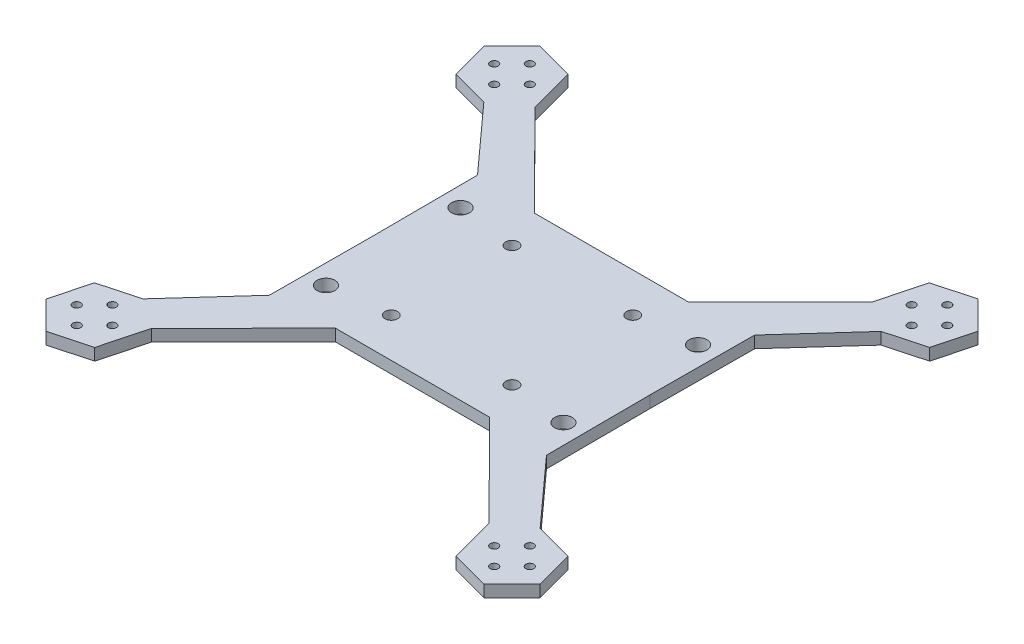
from build123d import *

# Parameters (mm, degrees)
SKETCH1_R           = 1
SKETCH1_R_2         = 2.25
SKETCH1_R_3         = 1.6
BOSS_EXTRUDE1_DEPTH = 3
SKETCH4_R           = 6.495043718
SKETCH4_R_2         = 4.9
BOSS_EXTRUDE3_DEPTH = 5
SKETCH6_W           = 8.48311055
SKETCH6_H           = 1.891574962
CUT_EXTRUDE3_DEPTH  = 34


with BuildPart() as part:
    # Sketch1 → Boss-Extrude1 (new body)
    with BuildSketch(Plane(origin=(0, 0, 0), x_dir=(1, 0, 0), z_dir=(0, 1, 0))):
        Polygon((43.076410298, 50.123925917), (42.618597625, 48.402115535), (19.4637773, 25.158118275), (-19.4637773, 25.158118275), (-42.618597625, 48.402115535), (-45.64603124, 59.788140743), (-55.300297258, 62.394891143), (-62.384942335, 55.337426715), (-59.815321393, 45.673211889), (-50.185022628, 43.072932893), (-35, 26.288270568), (-34.873, 0), (-35, -26.288270568), (-50.185022628, -43.072932893), (-59.815321393, -45.673211889), (-62.384942335, -55.337426715), (-55.300297258, -62.394891143), (-45.64603124, -59.788140743), (-42.618597625, -48.402115535), (-19.4637773, -25.158118275), (19.4637773, -25.158118275), (42.618597625, -48.402115535), (45.64603124, -59.788140743), (55.300297258, -62.394891143), (62.384942335, -55.337426715), (59.815321393, -45.673211889), (50.185022628, -43.072932893), (35, -26.288270568), (34.873, 0), (35, 26.288270568), (50.185022628, 43.072932893), (59.815321393, 45.673211889), (62.384942335, 55.337426715), (55.300297258, 62.394891143), (45.64603124, 59.788140743), align=None)
        with Locations((-52.730676316, -57.230676316)):
            Circle(SKETCH1_R, mode=Mode.SUBTRACT)
        with Locations((-57.230676316, -52.730676316)):
            Circle(SKETCH1_R, mode=Mode.SUBTRACT)
        with Locations((-48.230676316, -52.730676316)):
            Circle(SKETCH1_R, mode=Mode.SUBTRACT)
        with Locations((-52.730676316, -48.230676316)):
            Circle(SKETCH1_R, mode=Mode.SUBTRACT)
        with Locations((-30, -17)):
            Circle(SKETCH1_R_2, mode=Mode.SUBTRACT)
        with Locations((-15.25, -15.25)):
            Circle(SKETCH1_R_3, mode=Mode.SUBTRACT)
        with Locations((52.730676316, -57.230676316)):
            Circle(SKETCH1_R, mode=Mode.SUBTRACT)
        with Locations((48.230676316, -52.730676316)):
            Circle(SKETCH1_R, mode=Mode.SUBTRACT)
        with Locations((52.730676316, -48.230676316)):
            Circle(SKETCH1_R, mode=Mode.SUBTRACT)
        with Locations((57.230676316, -52.730676316)):
            Circle(SKETCH1_R, mode=Mode.SUBTRACT)
        with Locations((30, -17)):
            Circle(SKETCH1_R_2, mode=Mode.SUBTRACT)
        with Locations((15.25, -15.25)):
            Circle(SKETCH1_R_3, mode=Mode.SUBTRACT)
        with Locations((-15.25, 15.25)):
            Circle(SKETCH1_R_3, mode=Mode.SUBTRACT)
        with Locations((-30, 17)):
            Circle(SKETCH1_R_2, mode=Mode.SUBTRACT)
        with Locations((-57.230676316, 52.730676316)):
            Circle(SKETCH1_R, mode=Mode.SUBTRACT)
        with Locations((-52.730676316, 48.230676316)):
            Circle(SKETCH1_R, mode=Mode.SUBTRACT)
        with Locations((-48.230676316, 52.730676316)):
            Circle(SKETCH1_R, mode=Mode.SUBTRACT)
        with Locations((-52.730676316, 57.230676316)):
            Circle(SKETCH1_R, mode=Mode.SUBTRACT)
        with Locations((15.25, 15.25)):
            Circle(SKETCH1_R_3, mode=Mode.SUBTRACT)
        with Locations((30, 17)):
            Circle(SKETCH1_R_2, mode=Mode.SUBTRACT)
        with Locations((52.730676316, 48.230676316)):
            Circle(SKETCH1_R, mode=Mode.SUBTRACT)
        with Locations((48.230676316, 52.730676316)):
            Circle(SKETCH1_R, mode=Mode.SUBTRACT)
        with Locations((57.230676316, 52.730676316)):
            Circle(SKETCH1_R, mode=Mode.SUBTRACT)
        with Locations((52.730676316, 57.230676316)):
            Circle(SKETCH1_R, mode=Mode.SUBTRACT)
    extrude(amount=BOSS_EXTRUDE1_DEPTH)

    # Sketch4 → Boss-Extrude3 (add)
    with BuildSketch(Plane.XZ):
        Circle(SKETCH4_R)
        Circle(SKETCH4_R_2, mode=Mode.SUBTRACT)
    extrude(amount=BOSS_EXTRUDE3_DEPTH)

    # Sketch6 → Cut-Extrude3 (cut)
    with BuildSketch(Plane.XY.offset(25.158118275)):
        with Locations((0, -0.945787481)):
            Rectangle(SKETCH6_W, SKETCH6_H)
    extrude(amount=-CUT_EXTRUDE3_DEPTH, mode=Mode.SUBTRACT)


solid = part.part
